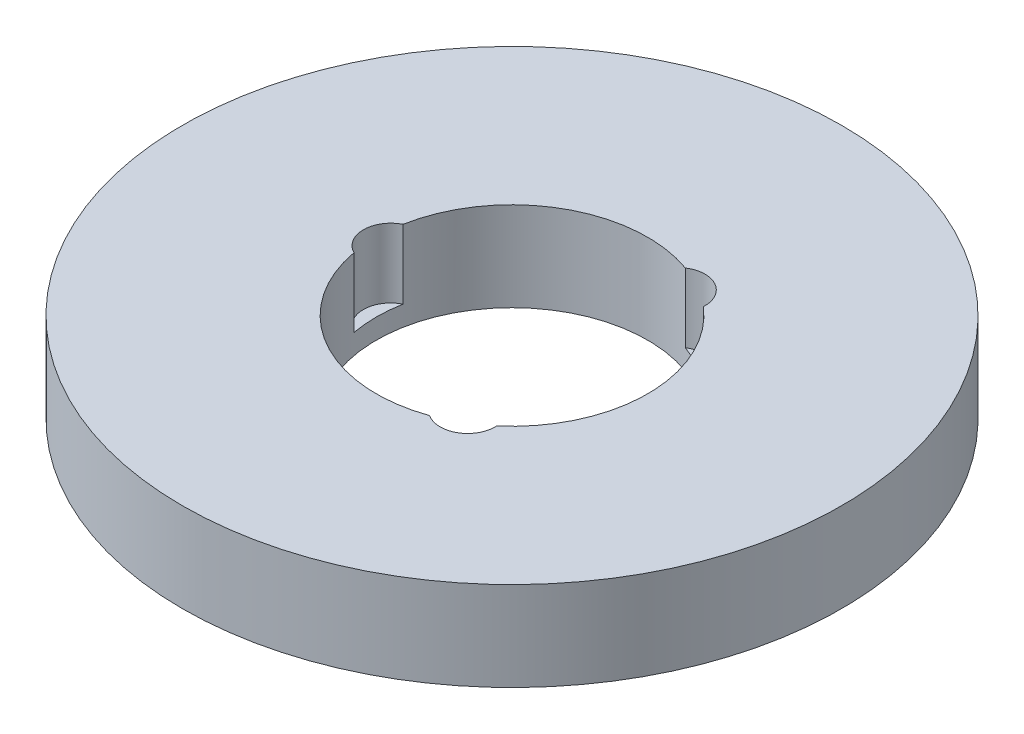
from build123d import *

# Parameters (mm, degrees)
SKETCH1_R           = 85
BOSS_EXTRUDE1_DEPTH = 23
SKETCH2_R           = 35
CUT_EXTRUDE1_DEPTH  = 123.388724971
SKETCH3_R           = 7.077409344
CUT_EXTRUDE2_DEPTH  = 17.828777388
CIRPATTERN1_COUNT   = 3


with BuildPart() as part:
    # Sketch1 → Boss-Extrude1 (new body)
    with BuildSketch(Plane(origin=(0, 0, 0), x_dir=(1, 0, 0), z_dir=(0, 1, 0))):
        Circle(SKETCH1_R)
    extrude(amount=BOSS_EXTRUDE1_DEPTH)

    # Sketch2 → Cut-Extrude1 (cut, through all)
    with BuildSketch(Plane(origin=(0, 0, 0), x_dir=(1, 0, 0), z_dir=(0, 1, 0))):
        Circle(SKETCH2_R)
    extrude(amount=CUT_EXTRUDE1_DEPTH, mode=Mode.SUBTRACT)

    # Sketch3 → Cut-Extrude2 (cut)
    with BuildSketch(Plane(origin=(0, 23, 0), x_dir=(1, 0, 0), z_dir=(0, 1, 0))):
        with Locations((-31.255145765, 0)):
            Circle(SKETCH3_R)
    cut_extrude2 = extrude(amount=-CUT_EXTRUDE2_DEPTH, mode=Mode.SUBTRACT)

    # CirPattern1: Cut-Extrude2 ×3 about axis
    cirpattern1_axis = Axis((0, 0, 0), (0, 1, 0))
    for i in range(1, CIRPATTERN1_COUNT):
        add(cut_extrude2.rotate(cirpattern1_axis, i * 360 / CIRPATTERN1_COUNT), mode=Mode.SUBTRACT)


solid = part.part
